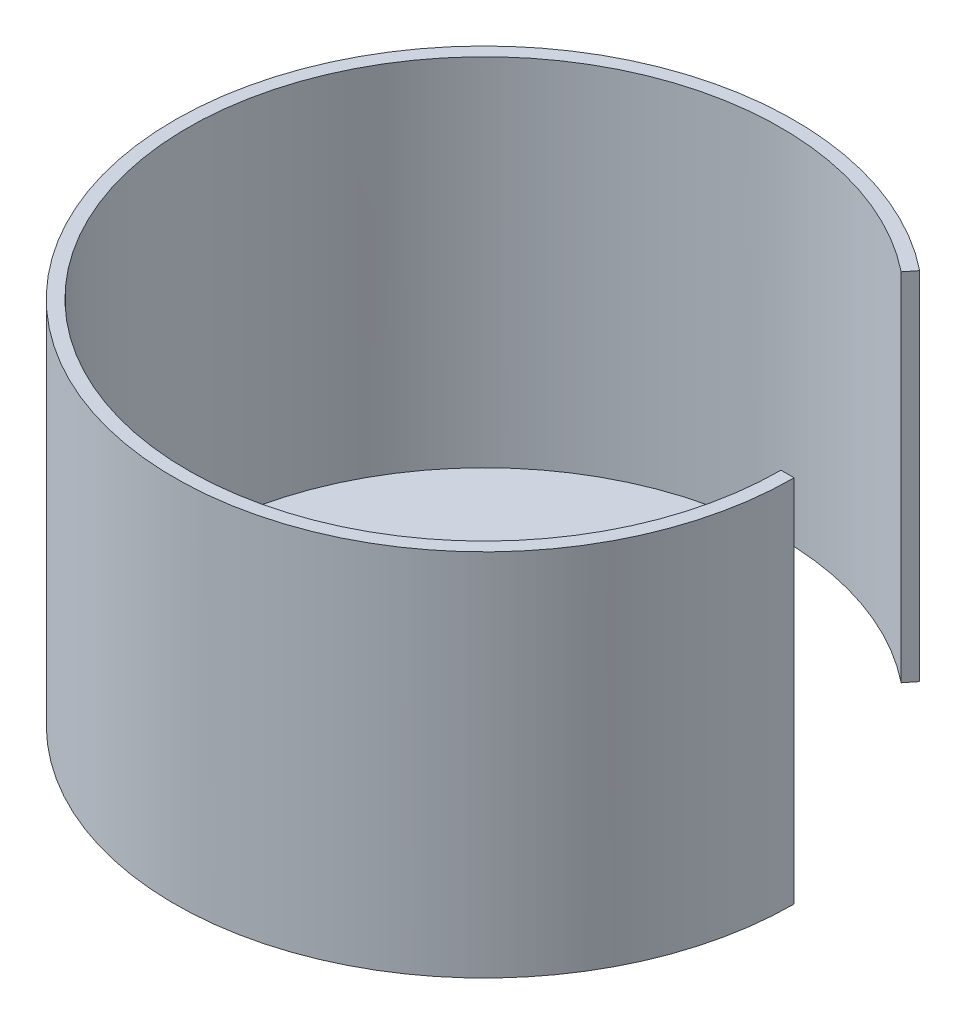
from build123d import *

# Parameters (mm, degrees)
BOSS_EXTRUDE1_DEPTH = 2
BOSS_EXTRUDE2_DEPTH = 54
CHAMFER1_SIZE2      = 14.230739445
CHAMFER1_SIZE       = 2


with BuildPart() as part:
    # Sketch1 → Boss-Extrude1 (new body)
    with BuildSketch(Plane(origin=(0, 0, 0), x_dir=(1, 0, 0), z_dir=(0, 1, 0))):
        with BuildLine():
            Line((-3.337814009, 14.623918683), (-10.458483896, 45.821611873))
            ThreePointArc((-10.458483896, 45.821611873), (-29.304020687, -36.746079676), (47, 0))
            Line((47, 0), (15, 0))
            ThreePointArc((15, 0), (9.352347028, 11.727472237), (-3.337814009, 14.623918683))
        make_face()
    extrude(amount=BOSS_EXTRUDE1_DEPTH)

    # Sketch2 → Boss-Extrude2 (add)
    with BuildSketch(Plane(origin=(0, 2, 0), x_dir=(1, 0, 0), z_dir=(0, 1, 0))):
        with BuildLine():
            Line((28.057041084, 35.182416711), (29.304020687, 36.746079676))
            ThreePointArc((29.304020687, 36.746079676), (-42.345536791, -20.392535739), (47, 0))
            Line((47, 0), (45, 0))
            ThreePointArc((45, 0), (-40.543599056, -19.52476826), (28.057041084, 35.182416711))
        make_face()
    extrude(amount=BOSS_EXTRUDE2_DEPTH)

    # Chamfer1
    chamfer1_edges = [part.edges().sort_by_distance(p)[0] for p in [
        (30, 2, 0),
    ]]
    chamfer1_side = [part.faces().sort_by_distance(p)[0] for p in [
        (30, 1.96, 0),
    ]]
    chamfer(chamfer1_edges, length=CHAMFER1_SIZE - 0.0001, length2=CHAMFER1_SIZE2 - 0.0001, reference=chamfer1_side[0])  # a hair under: the kernel refuses the full size


solid = part.part
